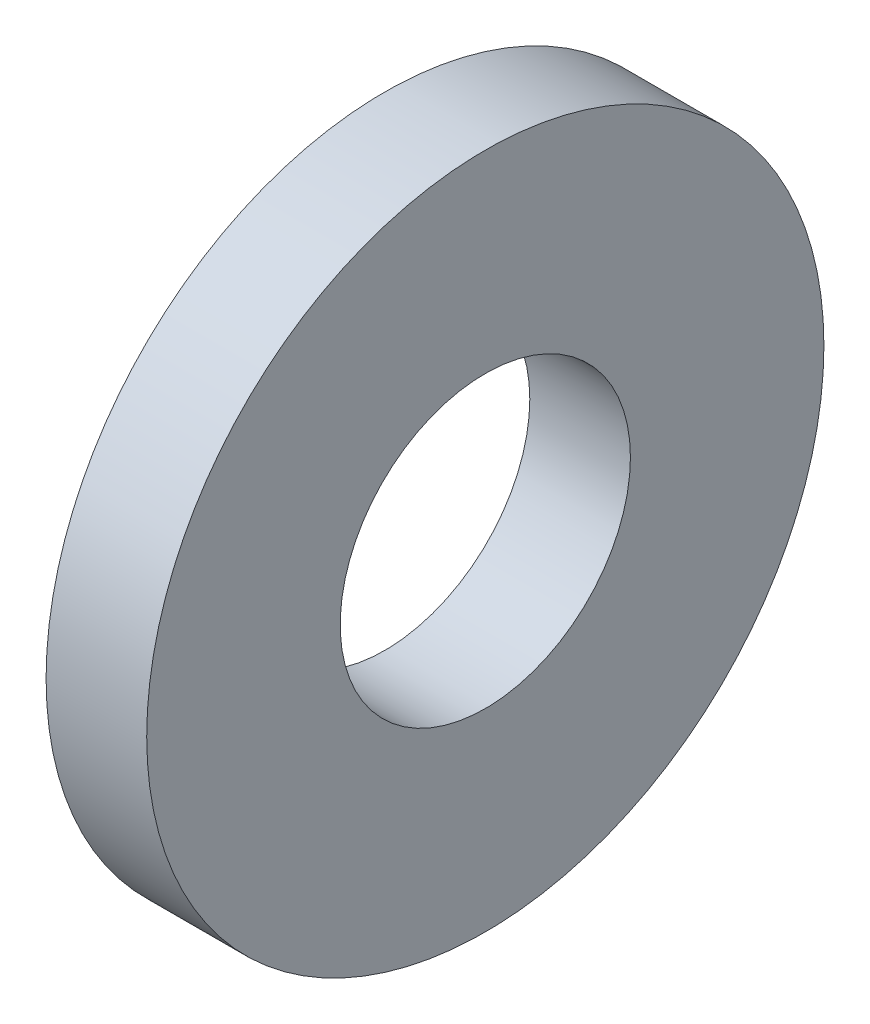
from build123d import *

# Parameters (mm, degrees)
SKETCH1_R           = 5.55625
SKETCH1_R_2         = 2.38125
BOSS_EXTRUDE1_DEPTH = 1.651


with BuildPart() as part:
    # Sketch1 → Boss-Extrude1 (new body)
    with BuildSketch(Plane(origin=(0, 0, 0), x_dir=(0, 0, -1), z_dir=(1, 0, 0))):
        Circle(SKETCH1_R)
        Circle(SKETCH1_R_2, mode=Mode.SUBTRACT)
    extrude(amount=BOSS_EXTRUDE1_DEPTH)


solid = part.part
